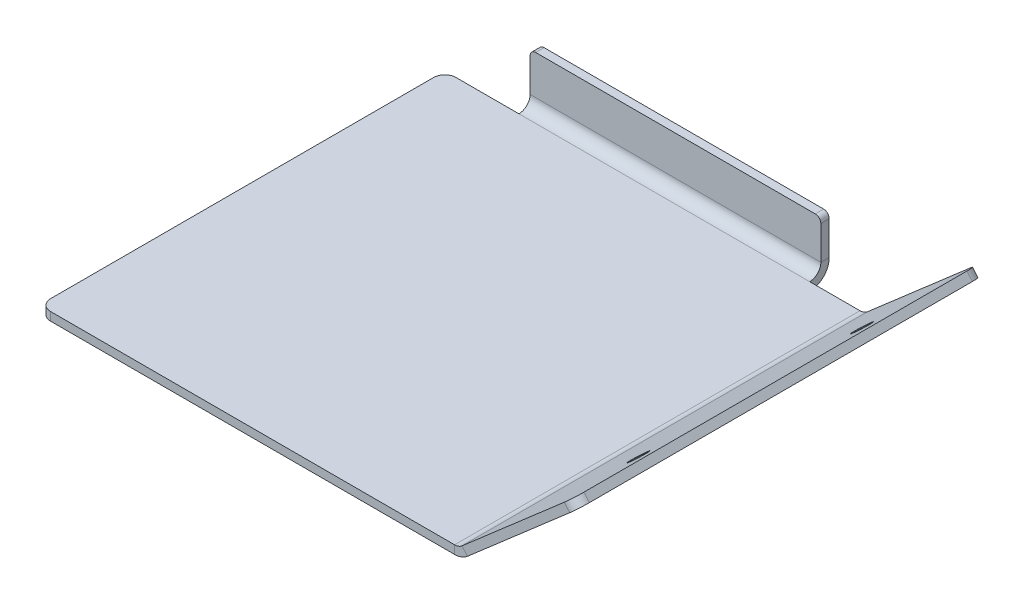
from build123d import *

# Parameters (mm, degrees)
T_LE_DE_BASE_PLI_E1_DEPTH                      = 72.5
CONG_1_R                                       = 2
FRAISAGE_POUR_VIS_T_TE_FRAIS_E_M31_D           = 3.4
FRAISAGE_POUR_VIS_T_TE_FRAIS_E_M31_CSINK_D     = 6.3
FRAISAGE_POUR_VIS_T_TE_FRAIS_E_M31_CSINK_ANGLE = 90
T_LE_PLI_E_SUR_AR_TE1_DEPTH                    = 52
CONG_2_R                                       = 1


# Sheet-metal steps are written as plain solids
with BuildPart() as part:
    # Esquisse1 → Tôle de base pliée1 (new body)
    with BuildSketch(Plane.XY):
        with BuildLine():
            Line((0, 0), (74.252230641, 0))
            ThreePointArc((74.252230641, 0), (74.952645404, 0.126655622), (75.564348699, 0.49058084))
            Line((75.564348699, 0.49058084), (95.377158666, 17.713593783))
            Line((95.377158666, 17.713593783), (96.36124721, 16.581529412))
            Line((96.36124721, 16.581529412), (76.548437242, -0.641483531))
            ThreePointArc((76.548437242, -0.641483531), (75.477956475, -1.278352662), (74.252230641, -1.5))
            Line((74.252230641, -1.5), (0, -1.5))
            Line((0, -1.5), (0, 0))
        make_face()
    extrude(amount=T_LE_DE_BASE_PLI_E1_DEPTH)

    # Congé1
    cong_1_edges = [part.edges().sort_by_distance(p)[0] for p in [
        (0, -0.75, 72.5),
        (95.869202938, 17.147561598, 72.5),
        (0, -0.75, 0),
        (95.869202938, 17.147561598, 0),
    ]]
    fillet(cong_1_edges, radius=CONG_1_R)

    # Fraisage pour vis à tête fraisée M31 (through all)
    with Locations(Plane(origin=(33.265097257, -38.267116948, 0), x_dir=(0, 0, -1), z_dir=(0.6560590289905085, -0.7547095802227711, 0))):
        with Locations((-56.25, 77.603218517), (-16.25, 77.603218517)):
            CounterSinkHole(FRAISAGE_POUR_VIS_T_TE_FRAIS_E_M31_D / 2, FRAISAGE_POUR_VIS_T_TE_FRAIS_E_M31_CSINK_D / 2, counter_sink_angle=FRAISAGE_POUR_VIS_T_TE_FRAIS_E_M31_CSINK_ANGLE)

    # Tôle pliée sur arête1 section (across the edge) → Tôle pliée sur arête1 (add)
    with BuildSketch(Plane(origin=(65.252230641, 0, -2), x_dir=(0, 0, 1), z_dir=(-1, 0, 0))):
        with BuildLine():
            Line((-1.5, 2), (-1.5, 9))
            Line((-1.5, 9), (0, 9))
            Line((0, 9), (0, 2))
            ThreePointArc((0, 2), (0.585786438, 0.585786438), (2, 0))
            Line((2, 0), (2, -1.5))
            ThreePointArc((2, -1.5), (-0.474873734, -0.474873734), (-1.5, 2))
        make_face()
    extrude(amount=T_LE_PLI_E_SUR_AR_TE1_DEPTH)

    # Congé2
    cong_2_edges = [part.edges().sort_by_distance(p)[0] for p in [
        (65.252230641, 9, -2.75),
        (13.252230641, 9, -2.75),
    ]]
    fillet(cong_2_edges, radius=CONG_2_R)


solid = part.part
